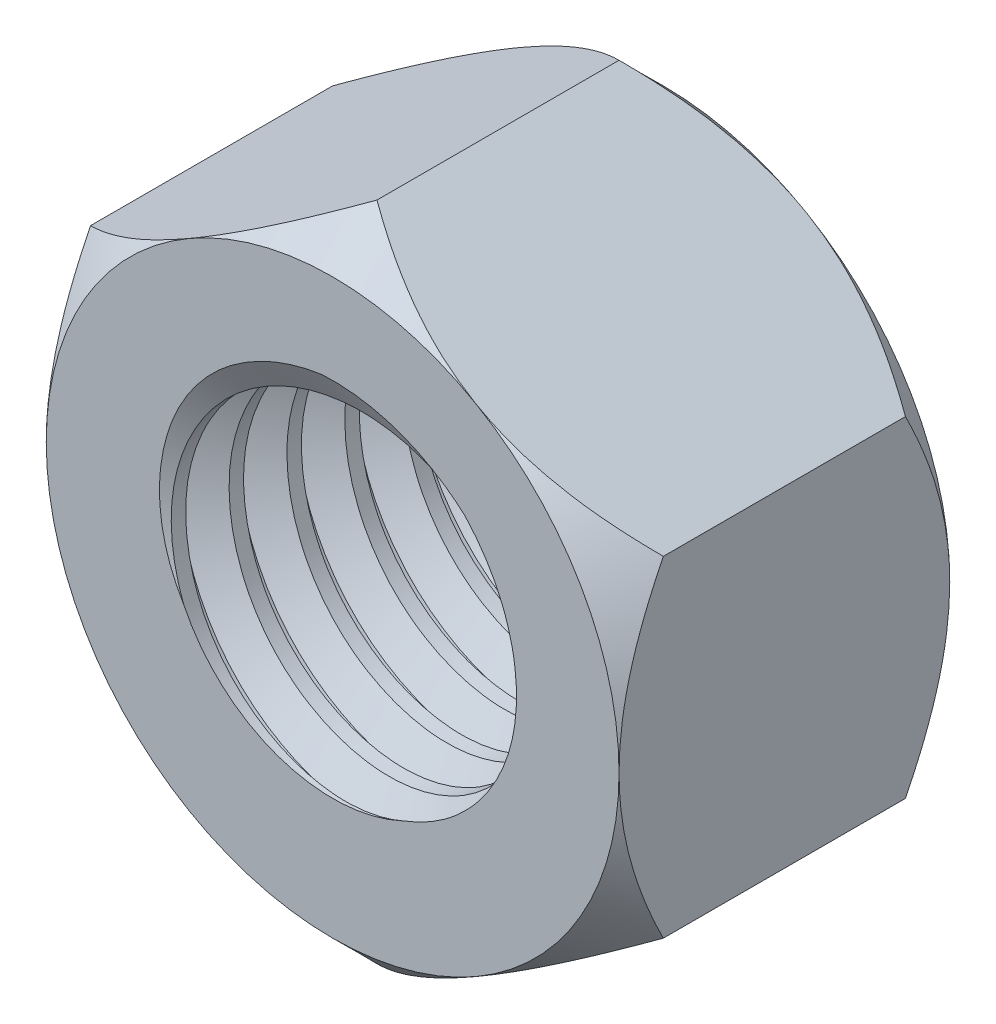
from build123d import *

# Parameters (mm, degrees)
SKETCH1_R           = 2
BOSS_EXTRUDE1_DEPTH = 2
THREAD2_PITCH       = 0.7
SKETCH9_OUTSIDE_W   = 19.19
SKETCH9_OUTSIDE_H   = 20.262
SKETCH9_OUTSIDE_R   = 3.464101615
CUT_EXTRUDE1_DEPTH  = 4
CUT_EXTRUDE1_DRAFT  = -45
SKETCH10_OUTSIDE_W  = 19.19
SKETCH10_OUTSIDE_H  = 20.262
SKETCH10_OUTSIDE_R  = 3.464101615
CUT_EXTRUDE2_DEPTH  = 4
CUT_EXTRUDE2_DRAFT  = -45


with BuildPart() as part:
    # Sketch1 → Boss-Extrude1 (new, symmetric)
    with BuildSketch(Plane.XY):
        Polygon((3.464101615, 2), (0, 4), (-3.464101615, 2), (-3.464101615, -2), (0, -4), (3.464101615, -2), align=None)
        Circle(SKETCH1_R, mode=Mode.SUBTRACT)
    extrude(amount=BOSS_EXTRUDE1_DEPTH, both=True)

    # Thread2: the profile of Thread Profile2 profile screwed along a right-hand helix of 14.285714 turns, 6 arcs to a turn; built about Z, then put on its axis
    thread2_z = Axis((0, 0, 0), (0, 0, 1))
    thread2_corners = [(1.9997, 0, -0.000173205), (2.378886113, 0, 0.218749999), (2.378886113, 0, 0.306249999), (1.9997, 0, 0.525173203)]
    with BuildLine(mode=Mode.PRIVATE) as thread2_profile:
        Line(thread2_corners[0], thread2_corners[1])
        Line(thread2_corners[1], thread2_corners[2])
        Line(thread2_corners[2], thread2_corners[3])
        Line(thread2_corners[3], thread2_corners[0])
    thread2_cap = Face(thread2_profile.wire())
    thread2_turn_angles = [0, 30, 60, 90, 120, 150, 180, 210, 240, 270, 300, 330, 360]
    thread2_turn_weights = [1, 0.8660254037844387, 1, 0.8660254037844387, 1, 0.8660254037844387, 1, 0.8660254037844387, 1, 0.8660254037844387, 1, 0.8660254037844387, 1]
    thread2_turn_rails = [Edge.make_bspline([Vector(p[0], p[1], 0).rotate(thread2_z, thread2_turn_angles[k]) / thread2_turn_weights[k] + Vector(0, 0, p[2] + THREAD2_PITCH * thread2_turn_angles[k] / 360) for k in range(13)], [0, 0, 0, 1, 1, 2, 2, 3, 3, 4, 4, 5, 5, 6, 6, 6], 2, thread2_turn_weights) for p in thread2_corners]
    thread2_turn_sides = [Face.make_surface_from_curves(thread2_turn_rails[p[0]], thread2_turn_rails[p[1]]) for p in [(0, 1), (1, 2), (2, 3), (3, 0)]]
    thread2_last_angles = [5040, 5070, 5100, 5121.428571429, 5142.857142857]
    thread2_last_weights = [1, 0.8660254037844387, 1, 0.9308737486442035, 1]
    thread2_last_rails = [Edge.make_bspline([Vector(p[0], p[1], 0).rotate(thread2_z, thread2_last_angles[k]) / thread2_last_weights[k] + Vector(0, 0, p[2] + THREAD2_PITCH * thread2_last_angles[k] / 360) for k in range(5)], [0, 0, 0, 1, 1, 2, 2, 2], 2, thread2_last_weights) for p in thread2_corners]
    thread2_last_sides = [Face.make_surface_from_curves(thread2_last_rails[p[0]], thread2_last_rails[p[1]]) for p in [(0, 1), (1, 2), (2, 3), (3, 0)]]
    thread2 = Plane(origin=(0, 0, -4), x_dir=(1, 0, 0), z_dir=(0, 0, 1)) * Solid(Shell([*[p.moved(Location((0, 0, THREAD2_PITCH * i))) for i in range(14) for p in thread2_turn_sides], *thread2_last_sides, thread2_cap, thread2_cap.rotate(thread2_z, 5142.857142857).moved(Location((0, 0, THREAD2_PITCH * 5142.857142857 / 360)))]))
    add(thread2, mode=Mode.SUBTRACT)


with BuildPart() as cut_extrude1_tool:
    # Sketch9 outside → Cut-Extrude1 (with draft: the straight prism first)
    with BuildSketch(Plane(origin=(0, 0, -2), x_dir=(-1, 0, 0), z_dir=(0, 0, -1))):
        Rectangle(SKETCH9_OUTSIDE_W, SKETCH9_OUTSIDE_H)
        Circle(SKETCH9_OUTSIDE_R, mode=Mode.SUBTRACT)
    extrude(amount=-CUT_EXTRUDE1_DEPTH)
    # Cut-Extrude1: the draft: its side faces are tilted about the plane it starts from
    cut_extrude1_sides = [cut_extrude1_tool.faces().sort_by_distance(p)[0] for p in [
        (0, -10.131, 0),
        (-9.595, 0, 0),
        (0, 10.131, 0),
        (9.595, 0, 0),
        (3.464101615, 0, 0),
    ]]
    draft(cut_extrude1_sides, Plane(origin=(0, 0, -2), x_dir=(-1, 0, 0), z_dir=(0, 0, -1)), CUT_EXTRUDE1_DRAFT)


with BuildPart() as part_1:
    add(part.part)

    # Cut-Extrude1: cut by cut_extrude1_tool
    add(cut_extrude1_tool.part, mode=Mode.SUBTRACT)


with BuildPart() as cut_extrude2_tool:
    # Sketch10 outside → Cut-Extrude2 (with draft: the straight prism first)
    with BuildSketch(Plane.XY.offset(2)):
        Rectangle(SKETCH10_OUTSIDE_W, SKETCH10_OUTSIDE_H)
        Circle(SKETCH10_OUTSIDE_R, mode=Mode.SUBTRACT)
    extrude(amount=-CUT_EXTRUDE2_DEPTH)
    # Cut-Extrude2: the draft: its side faces are tilted about the plane it starts from
    cut_extrude2_sides = [cut_extrude2_tool.faces().sort_by_distance(p)[0] for p in [
        (0, -10.131, 0),
        (9.595, 0, 0),
        (0, 10.131, 0),
        (-9.595, 0, 0),
        (-3.464101615, 0, 0),
    ]]
    draft(cut_extrude2_sides, Plane.XY.offset(2), CUT_EXTRUDE2_DRAFT)


with BuildPart() as part_2:
    add(part_1.part)

    # Cut-Extrude2: cut by cut_extrude2_tool
    add(cut_extrude2_tool.part, mode=Mode.SUBTRACT)


solid = part_2.part
